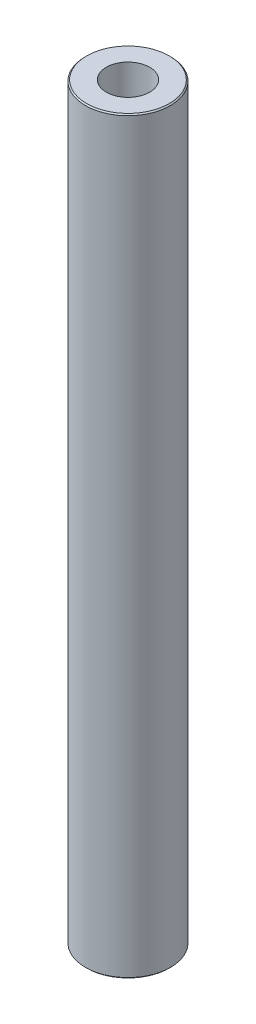
from build123d import *
from OCP.BRepFilletAPI import BRepFilletAPI_MakeChamfer

# Parameters (mm, degrees)
SKETCH1_R           = 10
BOSS_EXTRUDE1_DEPTH = 176.232016984
SKETCH2_R           = 5.099981806
CUT_EXTRUDE1_DEPTH  = 177.798540182
CHAMFER1_SIZE       = 0.277011615
CHAMFER1_SIZE2      = 0.280000242


with BuildPart() as part:
    # Sketch1 → Boss-Extrude1 (new body)
    with BuildSketch(Plane(origin=(0, 0, 0), x_dir=(1, 0, 0), z_dir=(0, 1, 0))):
        Circle(SKETCH1_R)
    extrude(amount=BOSS_EXTRUDE1_DEPTH)

    # Sketch2 → Cut-Extrude1 (cut, through all)
    with BuildSketch(Plane(origin=(0, 0, 0), x_dir=(1, 0, 0), z_dir=(0, 1, 0))):
        Circle(SKETCH2_R)
    extrude(amount=CUT_EXTRUDE1_DEPTH, mode=Mode.SUBTRACT)

    # Chamfer1: one chamfer whose edges measure the first distance from different faces: ONE call of the kernel's chamfer builder (chamfer() names one face for all edges)
    chamfer1_edges_1 = [part.edges().sort_by_distance(p)[0] for p in [
        (-10, 176.232016984, 0),
    ]]
    chamfer1_side_1 = [part.faces().sort_by_distance(p)[0] for p in [
        (-10, 88.116008492, 0),
    ]]
    chamfer1_edges_2 = [part.edges().sort_by_distance(p)[0] for p in [
        (-10, 0, 0),
    ]]
    chamfer1_side_2 = [part.faces().sort_by_distance(p)[0] for p in [
        (-9.717157288, 0, 0),
    ]]
    chamfer1 = BRepFilletAPI_MakeChamfer(part.part.solid().wrapped)
    for e in chamfer1_edges_1:
        chamfer1.Add(CHAMFER1_SIZE, CHAMFER1_SIZE2, e.wrapped, chamfer1_side_1[0].wrapped)  # the first distance lies on this face
    for e in chamfer1_edges_2:
        chamfer1.Add(CHAMFER1_SIZE, CHAMFER1_SIZE2, e.wrapped, chamfer1_side_2[0].wrapped)  # the first distance lies on this face
    add(Compound.cast(chamfer1.Shape()), mode=Mode.REPLACE)


solid = part.part
